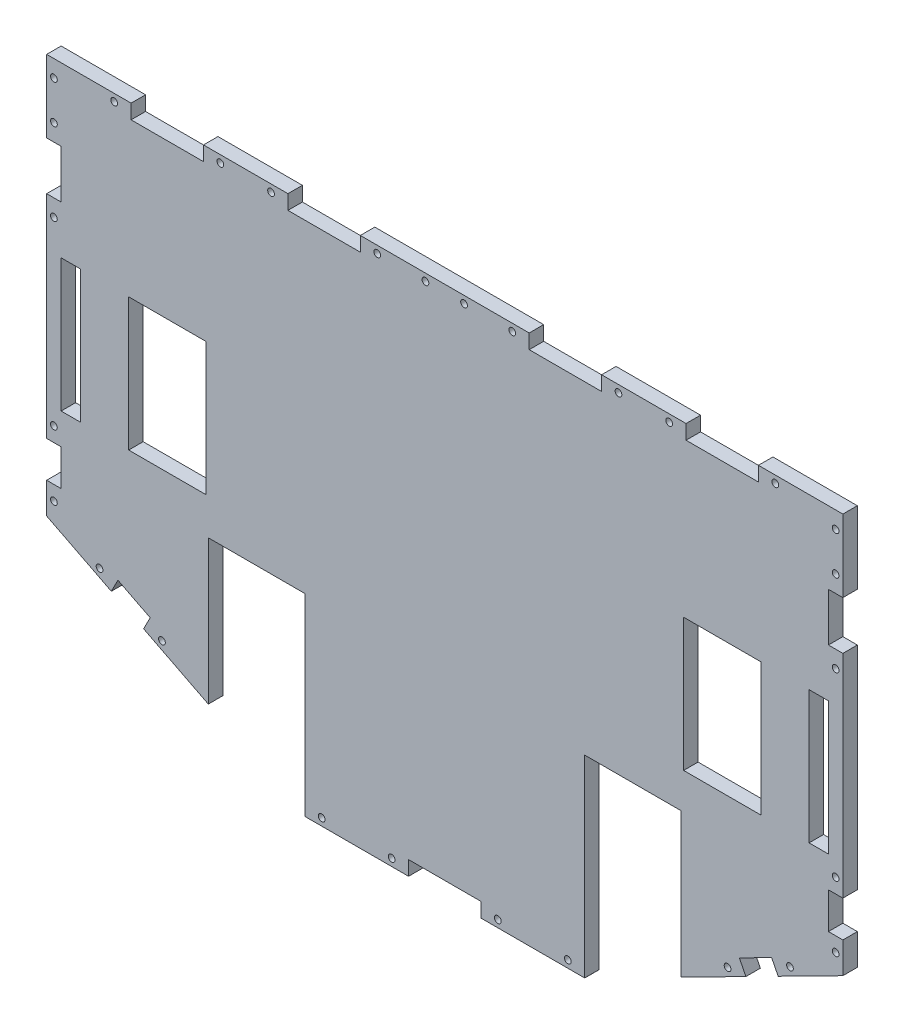
from build123d import *

# Parameters (mm, degrees)
BOSS_EXTRU_1_DEPTH      = 6
ESQUISSE2_W             = 8
ESQUISSE2_H             = 55
ESQUISSE2_W_2           = 32
ESQUISSE2_W_3           = 40
ESQUISSE2_H_2           = 80
ENL_V_MAT_EXTRU_1_DEPTH = 6
ESQUISSE8_W             = 6
ESQUISSE8_H             = 15
ESQUISSE8_H_2           = 20
ESQUISSE8_W_2           = 30
ESQUISSE8_H_3           = 6
ENL_V_MAT_EXTRU_2_DEPTH = 6
ESQUISSE9_R             = 1.4
ENL_V_MAT_EXTRU_3_DEPTH = 6


with BuildPart() as part:
    # Esquisse1 → Boss.-Extru.1 (new body)
    with BuildSketch(Plane.XY):
        Polygon((-165, 110.011553711), (165, 110.011553711), (165, -55.688446289), (58, -110.011553711), (-58, -110.011553711), (-165, -55.688446289), align=None)
    extrude(amount=BOSS_EXTRU_1_DEPTH)

    # Esquisse2 → Enlèv. mat.-Extru.1 (cut)
    with BuildSketch(Plane.XY.offset(6)):
        with Locations((-155, 12.488446289)):
            Rectangle(ESQUISSE2_W, ESQUISSE2_H)
        with Locations((-115, 12.488446289)):
            Rectangle(ESQUISSE2_W_2, ESQUISSE2_H)
        with Locations((115, 12.488446289)):
            Rectangle(ESQUISSE2_W_2, ESQUISSE2_H)
        with Locations((155, 12.488446289)):
            Rectangle(ESQUISSE2_W, ESQUISSE2_H)
        with Locations((78, -70)):
            Rectangle(ESQUISSE2_W_3, ESQUISSE2_H_2)
        with Locations((-78, -70)):
            Rectangle(ESQUISSE2_W_3, ESQUISSE2_H_2)
    extrude(amount=-ENL_V_MAT_EXTRU_1_DEPTH, mode=Mode.SUBTRACT)

    # Esquisse8 → Enlèv. mat.-Extru.2 (cut)
    with BuildSketch(Plane.XY.offset(6)):
        with Locations((-162, -35.348446289)):
            Rectangle(ESQUISSE8_W, ESQUISSE8_H)
        with Locations((-162, 70.011553711)):
            Rectangle(ESQUISSE8_W, ESQUISSE8_H_2)
        with Locations((-115, 107.011553711)):
            Rectangle(ESQUISSE8_W_2, ESQUISSE8_H_3)
        with Locations((-50, 107.011553711)):
            Rectangle(ESQUISSE8_W_2, ESQUISSE8_H_3)
        with Locations((162, -35.348446289)):
            Rectangle(ESQUISSE8_W, ESQUISSE8_H)
        with Locations((50, 107.011553711)):
            Rectangle(ESQUISSE8_W_2, ESQUISSE8_H_3)
        with Locations((115, 107.011553711)):
            Rectangle(ESQUISSE8_W_2, ESQUISSE8_H_3)
        with Locations((162, 70.011553711)):
            Rectangle(ESQUISSE8_W, ESQUISSE8_H_2)
        with Locations((0, -107.011553711)):
            Rectangle(ESQUISSE8_W_2, ESQUISSE8_H_3)
        Polygon((-138.187583333, -69.300911624), (-124.812583333, -76.091300052), (-122.096427962, -70.741300052), (-135.471427962, -63.950911624), align=None)
        Polygon((135.471427962, -63.950911624), (122.096427962, -70.741300052), (124.812583333, -76.091300052), (138.187583333, -69.300911624), align=None)
    extrude(amount=-ENL_V_MAT_EXTRU_2_DEPTH, mode=Mode.SUBTRACT)

    # Esquisse9 → Enlèv. mat.-Extru.3 (cut)
    with BuildSketch(Plane.XY.offset(6)):
        with Locations((-162, -48.848446289)):
            Circle(ESQUISSE9_R)
        with Locations((-162, -21.848446289)):
            Circle(ESQUISSE9_R)
        with Locations((-162, 53.011553711)):
            Circle(ESQUISSE9_R)
        with Locations((-162, 87.011553711)):
            Circle(ESQUISSE9_R)
        with Locations((-162, 103.011553711)):
            Circle(ESQUISSE9_R)
        with Locations((-137, 107.011553711)):
            Circle(ESQUISSE9_R)
        with Locations((-93, 107.011553711)):
            Circle(ESQUISSE9_R)
        with Locations((-72, 107.011553711)):
            Circle(ESQUISSE9_R)
        with Locations((-28, 107.011553711)):
            Circle(ESQUISSE9_R)
        with Locations((-8, 107.011553711)):
            Circle(ESQUISSE9_R)
        with Locations((8, 107.011553711)):
            Circle(ESQUISSE9_R)
        with Locations((28, 107.011553711)):
            Circle(ESQUISSE9_R)
        with Locations((72, 107.011553711)):
            Circle(ESQUISSE9_R)
        with Locations((93, 107.011553711)):
            Circle(ESQUISSE9_R)
        with Locations((137, 107.011553711)):
            Circle(ESQUISSE9_R)
        with Locations((162, 103.011553711)):
            Circle(ESQUISSE9_R)
        with Locations((162, 87.011553711)):
            Circle(ESQUISSE9_R)
        with Locations((162, 53.011553711)):
            Circle(ESQUISSE9_R)
        with Locations((162, -21.848446289)):
            Circle(ESQUISSE9_R)
        with Locations((162, -48.848446289)):
            Circle(ESQUISSE9_R)
        with Locations((-51, -107.011553711)):
            Circle(ESQUISSE9_R)
        with Locations((-22, -107.011553711)):
            Circle(ESQUISSE9_R)
        with Locations((22, -107.011553711)):
            Circle(ESQUISSE9_R)
        with Locations((51, -107.011553711)):
            Circle(ESQUISSE9_R)
        with Locations((-143.071172314, -63.457063691)):
            Circle(ESQUISSE9_R)
        with Locations((-117.212838981, -76.585147985)):
            Circle(ESQUISSE9_R)
        with Locations((117.212838981, -76.585147985)):
            Circle(ESQUISSE9_R)
        with Locations((143.071172314, -63.457063691)):
            Circle(ESQUISSE9_R)
    extrude(amount=-ENL_V_MAT_EXTRU_3_DEPTH, mode=Mode.SUBTRACT)


solid = part.part
